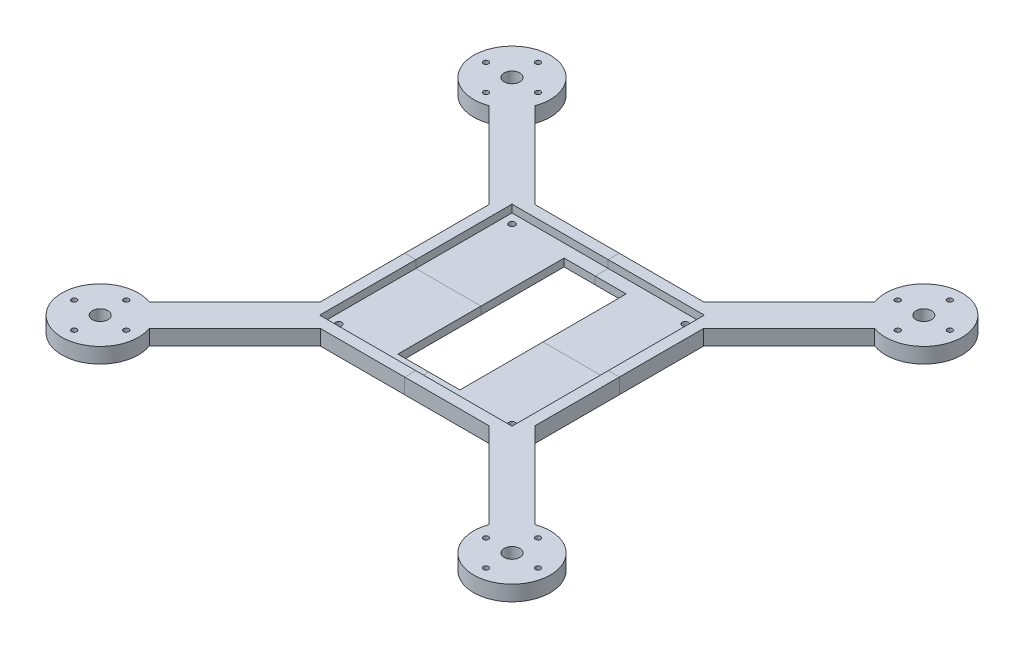
from build123d import *

# Parameters (mm, degrees)
SKETCH_1_R                       = 2
SKETCH_1_R_2                     = 1.7
SKETCH_1_R_3                     = 5.1
SKETCH_1_W                       = 40.5
SKETCH_1_H                       = 108.5
EXTRUDE_1_DEPTH                  = 10
SKETCH_4_W                       = 125.5
SKETCH_4_H                       = 125.5
CUT_EXTRUDE_1_DEPTH              = 5
SPLIT_BODIES_2_SURFACE_1_1_BACK  = 451.822
SPLIT_BODIES_2_SURFACE_1_1_DEPTH = 903.644
SPLIT_BODIES_2_SURFACE_1_2_BACK  = 451.822
SPLIT_BODIES_2_SURFACE_1_2_DEPTH = 903.644
SPLIT_BODIES_2_SURFACE_2_3_BACK  = 451.822
SPLIT_BODIES_2_SURFACE_2_3_DEPTH = 903.644
SPLIT_BODIES_2_SURFACE_2_4_BACK  = 451.822
SPLIT_BODIES_2_SURFACE_2_4_DEPTH = 903.644
SPLIT_BODIES_2_SURFACE_2_5_BACK  = 451.822
SPLIT_BODIES_2_SURFACE_2_5_DEPTH = 903.644
SPLIT_BODIES_2_SURFACE_2_6_BACK  = 451.822
SPLIT_BODIES_2_SURFACE_2_6_DEPTH = 903.644


with BuildPart() as part:
    # 스케치1 → 보스-돌출1 (new body)
    with BuildSketch(Plane(origin=(0, 0, 0), x_dir=(1, 0, 0), z_dir=(0, 1, 0))):
        with BuildLine():
            Line((55, 70), (110.842477832, 125.842477832))
            ThreePointArc((110.842477832, 125.842477832), (152.027957955, 152.027957955), (125.842477832, 110.842477832))
            Line((125.842477832, 110.842477832), (70, 55))
            Line((70, 55), (70, -55))
            Line((70, -55), (125.842477832, -110.842477832))
            ThreePointArc((125.842477832, -110.842477832), (152.027957955, -152.027957955), (110.842477832, -125.842477832))
            Line((110.842477832, -125.842477832), (55, -70))
            Line((55, -70), (-55, -70))
            Line((-55, -70), (-110.842477832, -125.842477832))
            ThreePointArc((-110.842477832, -125.842477832), (-152.027957955, -152.027957955), (-125.842477832, -110.842477832))
            Line((-125.842477832, -110.842477832), (-70, -55))
            Line((-70, -55), (-70, 55))
            Line((-70, 55), (-125.842477832, 110.842477832))
            ThreePointArc((-125.842477832, 110.842477832), (-152.027957955, 152.027957955), (-110.842477832, 125.842477832))
            Line((-110.842477832, 125.842477832), (-55, 70))
            Line((-55, 70), (55, 70))
        make_face()
        with Locations((-56.5, -56.5)):
            Circle(SKETCH_1_R, mode=Mode.SUBTRACT)
        with Locations((56.5, -56.5)):
            Circle(SKETCH_1_R, mode=Mode.SUBTRACT)
        with Locations((56.5, 56.5)):
            Circle(SKETCH_1_R, mode=Mode.SUBTRACT)
        with Locations((-56.5, 56.5)):
            Circle(SKETCH_1_R, mode=Mode.SUBTRACT)
        with Locations((134.350288425, 117.350288425)):
            Circle(SKETCH_1_R_2, mode=Mode.SUBTRACT)
        with Locations((117.350288425, 134.350288425)):
            Circle(SKETCH_1_R_2, mode=Mode.SUBTRACT)
        with Locations((151.350288425, 134.350288425)):
            Circle(SKETCH_1_R_2, mode=Mode.SUBTRACT)
        with Locations((134.350288425, 151.350288425)):
            Circle(SKETCH_1_R_2, mode=Mode.SUBTRACT)
        with Locations((134.350288425, 134.350288425)):
            Circle(SKETCH_1_R_3, mode=Mode.SUBTRACT)
        with Locations((117.350288425, -134.350288425)):
            Circle(SKETCH_1_R_2, mode=Mode.SUBTRACT)
        with Locations((134.350288425, -117.350288425)):
            Circle(SKETCH_1_R_2, mode=Mode.SUBTRACT)
        with Locations((134.350288425, -151.350288425)):
            Circle(SKETCH_1_R_2, mode=Mode.SUBTRACT)
        with Locations((151.350288425, -134.350288425)):
            Circle(SKETCH_1_R_2, mode=Mode.SUBTRACT)
        with Locations((134.350288425, -134.350288425)):
            Circle(SKETCH_1_R_3, mode=Mode.SUBTRACT)
        with Locations((-134.350288425, -117.350288425)):
            Circle(SKETCH_1_R_2, mode=Mode.SUBTRACT)
        with Locations((-117.350288425, -134.350288425)):
            Circle(SKETCH_1_R_2, mode=Mode.SUBTRACT)
        with Locations((-151.350288425, -134.350288425)):
            Circle(SKETCH_1_R_2, mode=Mode.SUBTRACT)
        with Locations((-134.350288425, -151.350288425)):
            Circle(SKETCH_1_R_2, mode=Mode.SUBTRACT)
        with Locations((-134.350288425, -134.350288425)):
            Circle(SKETCH_1_R_3, mode=Mode.SUBTRACT)
        with Locations((-117.350288425, 134.350288425)):
            Circle(SKETCH_1_R_2, mode=Mode.SUBTRACT)
        with Locations((-134.350288425, 117.350288425)):
            Circle(SKETCH_1_R_2, mode=Mode.SUBTRACT)
        with Locations((-134.350288425, 151.350288425)):
            Circle(SKETCH_1_R_2, mode=Mode.SUBTRACT)
        with Locations((-151.350288425, 134.350288425)):
            Circle(SKETCH_1_R_2, mode=Mode.SUBTRACT)
        with Locations((-134.350288425, 134.350288425)):
            Circle(SKETCH_1_R_3, mode=Mode.SUBTRACT)
        Rectangle(SKETCH_1_W, SKETCH_1_H, mode=Mode.SUBTRACT)
    extrude(amount=-EXTRUDE_1_DEPTH)

    # 스케치4 → 컷-돌출1 (cut)
    with BuildSketch(Plane(origin=(0, 0, 0), x_dir=(1, 0, 0), z_dir=(0, 1, 0))):
        Rectangle(SKETCH_4_W, SKETCH_4_H)
    extrude(amount=-CUT_EXTRUDE_1_DEPTH, mode=Mode.SUBTRACT)


with BuildPart() as body_2:
    # Split Bodies 2: the piece behind the surface
    add(part.part)
    # Split Bodies 2 surface 1: a surface, the sketch's curves swept straight by 903.644 mm
    with BuildLine(Plane(origin=(0, 0, 0), x_dir=(1, 0, 0), z_dir=(0, 1, 0)).offset(-SPLIT_BODIES_2_SURFACE_1_1_BACK), mode=Mode.PRIVATE) as split_bodies_2_surface_1_1_path:
        Line((0, 70), (0, -70))
    split_bodies_2_surface_1_1 = Shell.extrude(split_bodies_2_surface_1_1_path.wire(), (0 * SPLIT_BODIES_2_SURFACE_1_1_DEPTH, 1 * SPLIT_BODIES_2_SURFACE_1_1_DEPTH, 0 * SPLIT_BODIES_2_SURFACE_1_1_DEPTH))
    split(bisect_by=split_bodies_2_surface_1_1, keep=Keep.BOTTOM)


with BuildPart() as part_1:
    add(part.part)

    # Split Bodies 2: split by a surface, the side it looks to stays
    # Split Bodies 2 surface 1: a surface, the sketch's curves swept straight by 903.644 mm
    with BuildLine(Plane(origin=(0, 0, 0), x_dir=(1, 0, 0), z_dir=(0, 1, 0)).offset(-SPLIT_BODIES_2_SURFACE_1_2_BACK), mode=Mode.PRIVATE) as split_bodies_2_surface_1_2_path:
        Line((0, 70), (0, -70))
    split_bodies_2_surface_1_2 = Shell.extrude(split_bodies_2_surface_1_2_path.wire(), (0 * SPLIT_BODIES_2_SURFACE_1_2_DEPTH, 1 * SPLIT_BODIES_2_SURFACE_1_2_DEPTH, 0 * SPLIT_BODIES_2_SURFACE_1_2_DEPTH))
    split(bisect_by=split_bodies_2_surface_1_2, keep=Keep.TOP)


with BuildPart() as body_3:
    # Split Bodies 2 2: the piece behind the surface
    add(part_1.part)
    # Split Bodies 2 surface 2: a surface, the sketch's curves swept straight by 903.644 mm
    with BuildLine(Plane(origin=(0, 0, 0), x_dir=(1, 0, 0), z_dir=(0, 1, 0)).offset(-SPLIT_BODIES_2_SURFACE_2_3_BACK), mode=Mode.PRIVATE) as split_bodies_2_surface_2_3_path:
        Line((-70, 0), (70, 0))
    split_bodies_2_surface_2_3 = Shell.extrude(split_bodies_2_surface_2_3_path.wire(), (0 * SPLIT_BODIES_2_SURFACE_2_3_DEPTH, 1 * SPLIT_BODIES_2_SURFACE_2_3_DEPTH, 0 * SPLIT_BODIES_2_SURFACE_2_3_DEPTH))
    split(bisect_by=split_bodies_2_surface_2_3, keep=Keep.BOTTOM)


with BuildPart() as part_2:
    add(part_1.part)

    # Split Bodies 2 2: split by a surface, the side it looks to stays
    # Split Bodies 2 surface 2: a surface, the sketch's curves swept straight by 903.644 mm
    with BuildLine(Plane(origin=(0, 0, 0), x_dir=(1, 0, 0), z_dir=(0, 1, 0)).offset(-SPLIT_BODIES_2_SURFACE_2_4_BACK), mode=Mode.PRIVATE) as split_bodies_2_surface_2_4_path:
        Line((-70, 0), (70, 0))
    split_bodies_2_surface_2_4 = Shell.extrude(split_bodies_2_surface_2_4_path.wire(), (0 * SPLIT_BODIES_2_SURFACE_2_4_DEPTH, 1 * SPLIT_BODIES_2_SURFACE_2_4_DEPTH, 0 * SPLIT_BODIES_2_SURFACE_2_4_DEPTH))
    split(bisect_by=split_bodies_2_surface_2_4, keep=Keep.TOP)


with BuildPart() as body_4:
    # Split Bodies 2 2 body 2: the piece behind the surface
    add(body_2.part)
    # Split Bodies 2 surface 2: a surface, the sketch's curves swept straight by 903.644 mm
    with BuildLine(Plane(origin=(0, 0, 0), x_dir=(1, 0, 0), z_dir=(0, 1, 0)).offset(-SPLIT_BODIES_2_SURFACE_2_5_BACK), mode=Mode.PRIVATE) as split_bodies_2_surface_2_5_path:
        Line((-70, 0), (70, 0))
    split_bodies_2_surface_2_5 = Shell.extrude(split_bodies_2_surface_2_5_path.wire(), (0 * SPLIT_BODIES_2_SURFACE_2_5_DEPTH, 1 * SPLIT_BODIES_2_SURFACE_2_5_DEPTH, 0 * SPLIT_BODIES_2_SURFACE_2_5_DEPTH))
    split(bisect_by=split_bodies_2_surface_2_5, keep=Keep.BOTTOM)


with BuildPart() as body_2_1:
    add(body_2.part)

    # Split Bodies 2 2 body 2: split by a surface, the side it looks to stays
    # Split Bodies 2 surface 2: a surface, the sketch's curves swept straight by 903.644 mm
    with BuildLine(Plane(origin=(0, 0, 0), x_dir=(1, 0, 0), z_dir=(0, 1, 0)).offset(-SPLIT_BODIES_2_SURFACE_2_6_BACK), mode=Mode.PRIVATE) as split_bodies_2_surface_2_6_path:
        Line((-70, 0), (70, 0))
    split_bodies_2_surface_2_6 = Shell.extrude(split_bodies_2_surface_2_6_path.wire(), (0 * SPLIT_BODIES_2_SURFACE_2_6_DEPTH, 1 * SPLIT_BODIES_2_SURFACE_2_6_DEPTH, 0 * SPLIT_BODIES_2_SURFACE_2_6_DEPTH))
    split(bisect_by=split_bodies_2_surface_2_6, keep=Keep.TOP)


solid = Compound([body_3.part, part_2.part, body_4.part, body_2_1.part])
